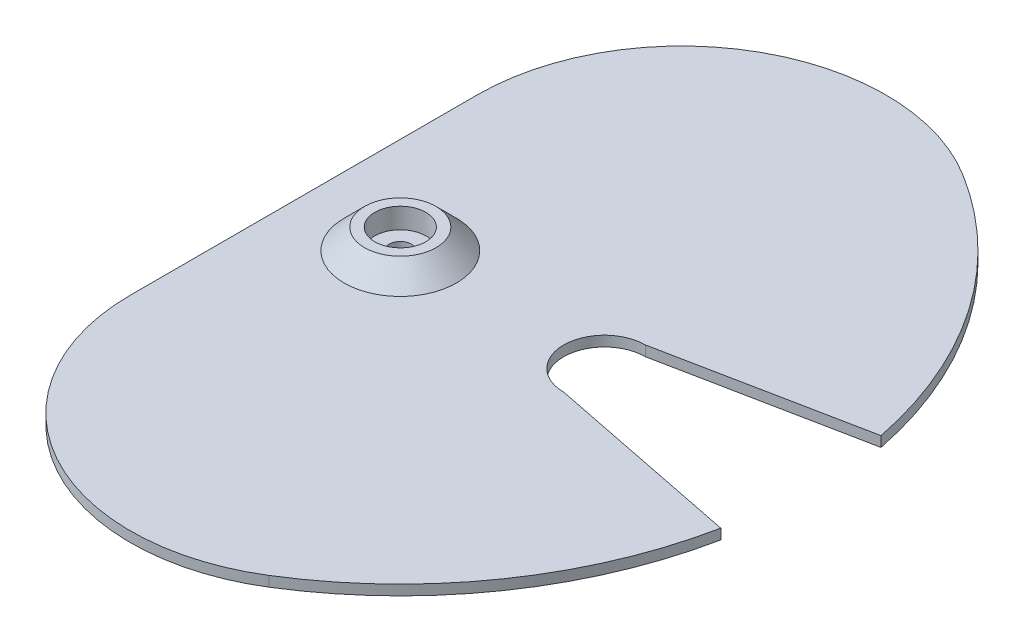
from build123d import *

# Parameters (mm, degrees)
ESBO_O1_R                = 40
RESSALTO_EXTRUS_O1_DEPTH = 1
ESBO_O3_R                = 3.5
RESSALTO_EXTRUS_O2_DEPTH = 2
ESBO_O4_R                = 2.5
CORTE_EXTRUS_O2_DEPTH    = 2
CHANFRO1_SIZE            = 2
ESBO_O6_R                = 1.1
CORTE_EXTRUS_O4_DEPTH    = 3
CORTE_EXTRUS_O5_START    = -3
CORTE_EXTRUS_O5_DEPTH    = 3
ESBO_O7_W                = 38.307647293
ESBO_O7_H                = 77.740133008
CORTE_EXTRUS_O6_DEPTH    = 3
FILETE1_R                = 20
FILETE2_R                = 20


with BuildPart() as part:
    # Esboço1 → Ressalto-extrusão1 (new body)
    with BuildSketch(Plane(origin=(0, 0, 0), x_dir=(1, 0, 0), z_dir=(0, 1, 0))):
        with Locations(Location((0, 0, 0), (0, 0, 270))):
            Circle(ESBO_O1_R)
    extrude(amount=RESSALTO_EXTRUS_O1_DEPTH)

    # Esboço3 → Ressalto-extrusão2 (add)
    with BuildSketch(Plane(origin=(0, 1, 0), x_dir=(1, 0, 0), z_dir=(0, 1, 0))):
        with Locations(Location((0, 0, 0), (0, 0, 270))):
            Circle(ESBO_O3_R)
    extrude(amount=RESSALTO_EXTRUS_O2_DEPTH)

    # Esboço4 → Corte-extrusão2 (cut)
    with BuildSketch(Plane(origin=(0, 3, 0), x_dir=(1, 0, 0), z_dir=(0, 1, 0))):
        with Locations(Location((0, 0, 0), (0, 0, 270))):
            Circle(ESBO_O4_R)
    extrude(amount=-CORTE_EXTRUS_O2_DEPTH, mode=Mode.SUBTRACT)

    # Chanfro1
    chanfro1_edges = [part.edges().sort_by_distance(p)[0] for p in [
        (0, 1, -3.5),
    ]]
    chamfer(chanfro1_edges, length=CHANFRO1_SIZE - 0.0001)  # a hair under: the kernel refuses the full size

    # Esboço6 → Corte-extrusão4 (cut)
    with BuildSketch(Plane(origin=(0, 1, 0), x_dir=(1, 0, 0), z_dir=(0, 1, 0))):
        with Locations(Location((0, 0, 0), (0, 0, 270))):
            Circle(ESBO_O6_R)
    extrude(amount=-CORTE_EXTRUS_O4_DEPTH, mode=Mode.SUBTRACT)

    # Esboço2 → Corte-extrusão5 (cut)
    with BuildSketch(Plane(origin=(0, 1, 0), x_dir=(1, 0, 0), z_dir=(0, 1, 0)).offset(CORTE_EXTRUS_O5_START)):
        with BuildLine():
            ThreePointArc((20, 4), (16, 0), (20, -4))
            Line((20, -4), (39.223227028, -7.844645406))
            ThreePointArc((39.223227028, -7.844645406), (40, 0), (39.223227028, 7.844645406))
            Line((39.223227028, 7.844645406), (20, 4))
        make_face()
    extrude(amount=CORTE_EXTRUS_O5_DEPTH, mode=Mode.SUBTRACT)

    # Esboço7 → Corte-extrusão6 (cut)
    with BuildSketch(Plane(origin=(0, 1, 0), x_dir=(1, 0, 0), z_dir=(0, 1, 0))):
        with Locations((-28.594052983, 0)):
            Rectangle(ESBO_O7_W, ESBO_O7_H)
    extrude(amount=-CORTE_EXTRUS_O6_DEPTH, mode=Mode.SUBTRACT)

    # Filete1
    filete1_edges = [part.edges().sort_by_distance(p)[0] for p in [
        (-9.440229337, 0.5, -38.870066504),
    ]]
    fillet(filete1_edges, radius=FILETE1_R)

    # Filete2
    filete2_edges = [part.edges().sort_by_distance(p)[0] for p in [
        (-9.440229337, 0.5, 38.870066504),
    ]]
    fillet(filete2_edges, radius=FILETE2_R)


solid = part.part
